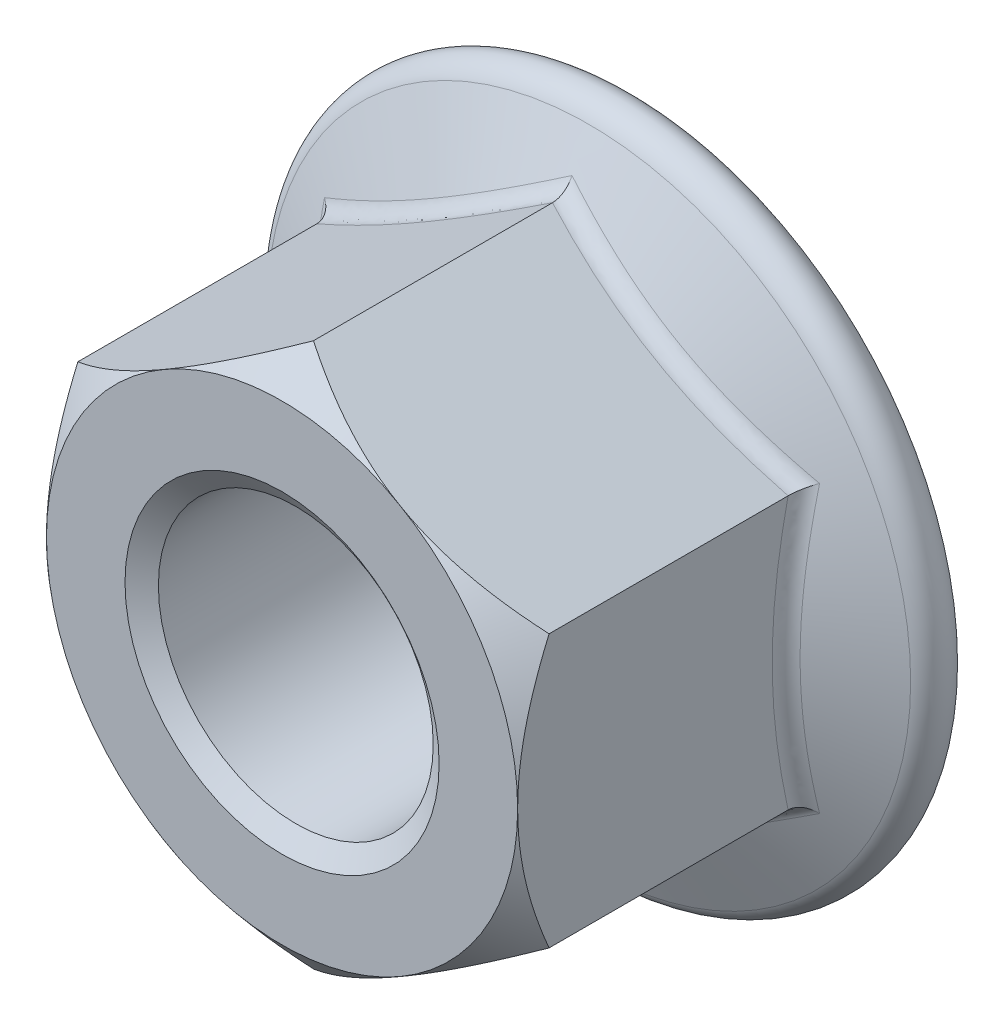
from build123d import *

# Parameters (mm, degrees)
BASENUT_START  = -22.5298
BASENUTSKE_R   = 8.75
BASENUT_DEPTH  = 22.5298
FLANGEFILLET_R = 1.2


# Read off the part's stored shape, not the designer's step: ThreadSchematic
with BuildPart() as part:
    # BaseNutSke → BaseNut (new body)
    with BuildSketch(Plane.XY.offset(BASENUT_START)):
        Polygon((15, 8.660254038), (15, -8.660254038), (0, -17.320508076), (-15, -8.660254038), (-15, 8.660254038), (0, 17.320508076), align=None)
        Circle(BASENUTSKE_R, mode=Mode.SUBTRACT)
    extrude(amount=BASENUT_DEPTH)

    # Sketch5 (on Right Plane) → EndChamfer (revolve, cut)
    with BuildSketch(Plane(origin=(0, 0, 0), x_dir=(0, 0, -1), z_dir=(1, 0, 0)), mode=Mode.PRIVATE) as endchamfer_sk:
        Polygon((22.5044, 10), (21.541614635, 8.625), (22.5552, 8.625), (22.5552, 10), align=None)
    revolve(endchamfer_sk.sketch.rotate(Axis((0, 0, -25.037505729), (0, 0, -1)), 90), axis=Axis((0, 0, -25.037505729), (0, 0, -1)), mode=Mode.SUBTRACT)

    # Sketch6 → Flange (revolve)
    with BuildSketch(Plane(origin=(0, 0, 0), x_dir=(0, 0, -1), z_dir=(1, 0, 0)), mode=Mode.PRIVATE) as flange_sk:
        with BuildLine():
            Line((14.054713354, 8.75), (19.5298, 20.491361203))
            ThreePointArc((19.5298, 20.491361203), (21.296693167, 21.362696486), (22.5298, 19.826277215))
            Line((22.5298, 19.826277215), (22.5298, 8.75))
            Line((22.5298, 8.75), (14.054713354, 8.75))
        make_face()
    revolve(flange_sk.sketch.rotate(Axis((0, 0, 0), (0, 0, -1)), 90), axis=Axis((0, 0, 0), (0, 0, -1)))

    # Sketch3 → Double-Chamfer (revolve, cut)
    with BuildSketch(Plane(origin=(0, 0, 0), x_dir=(0, 0, -1), z_dir=(1, 0, 0)), mode=Mode.PRIVATE) as double_chamfer_sk:
        Polygon((2, 30.020508076), (-12.7, 30.020508076), (-12.7, 15), (0, 15), (2, 17.320508076), align=None)
    revolve(double_chamfer_sk.sketch.rotate(Axis((0, 0, 0), (0, 0, -1)), 90), axis=Axis((0, 0, 0), (0, 0, -1)), mode=Mode.SUBTRACT)

    # FlangeFillet
    flangefillet_edges = [part.edges().sort_by_distance(p)[0] for p in [
        (15, 4.360902564, -17.25874059),
        (7.5, 12.990381057, -16.969136217),
        (-7.5, 12.990381057, -16.969136217),
        (-15, 0, -16.969136217),
        (-7.5, -12.990381057, -16.969136217),
        (7.5, -12.990381057, -16.969136217),
        (15, -4.360902564, -17.25874059),
    ]]
    fillet(flangefillet_edges, radius=FLANGEFILLET_R)

    # ThreadSchematic outline → ThreadSchematic (revolve, cut)
    with BuildSketch(Plane.XZ):
        Polygon((8.75, 0), (8.75, -0.875259423), (10, 0), align=None)
        Polygon((10, -22.5044), (8.75, -21.629140577), (8.75, -22.5298), (10, -22.5298), align=None)
    revolve(axis=Axis((0, 0, 0), (0, 0, 1)), mode=Mode.SUBTRACT)


solid = part.part
